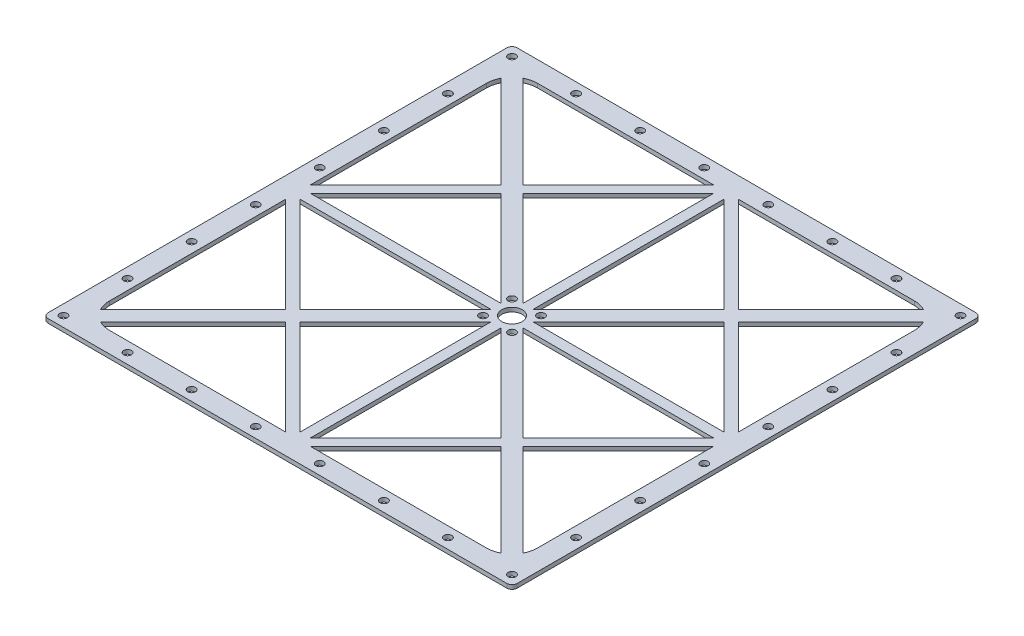
from build123d import *

# Parameters (mm, degrees)
SKETCH1_W           = 183
SKETCH1_H           = 183
SKETCH1_R           = 1.5
BOSS_EXTRUDE1_DEPTH = 1.6
CUT_EXTRUDE1_DEPTH  = 2
FILLET1_R           = 2
SKETCH3_R           = 1.5
CUT_EXTRUDE2_DEPTH  = 259.806027751
BOSS_EXTRUDE2_DEPTH = 1.6
SKETCH8_R           = 4
CUT_EXTRUDE4_DEPTH  = 259.806027751
BOSS_EXTRUDE4_DEPTH = 1.6
SKETCH7_R           = 1.5
CUT_EXTRUDE3_DEPTH  = 1.6


with BuildPart() as part:
    # Sketch1 → Boss-Extrude1 (new body)
    with BuildSketch(Plane(origin=(0, 0, 0), x_dir=(1, 0, 0), z_dir=(0, 1, 0))):
        with Locations((91.5, 91.5)):
            Rectangle(SKETCH1_W, SKETCH1_H)
        with Locations(Location((85.843145751, 97.156854249, 0), (0, 0, 270))):
            Circle(SKETCH1_R, mode=Mode.SUBTRACT)
        with Locations(Location((97.156854249, 97.156854249, 0), (0, 0, 270))):
            Circle(SKETCH1_R, mode=Mode.SUBTRACT)
        with Locations(Location((97.156854249, 85.843145751, 0), (0, 0, 270))):
            Circle(SKETCH1_R, mode=Mode.SUBTRACT)
        with Locations(Location((85.843145751, 85.843145751, 0), (0, 0, 270))):
            Circle(SKETCH1_R, mode=Mode.SUBTRACT)
    extrude(amount=BOSS_EXTRUDE1_DEPTH)

    # Sketch2 → Cut-Extrude1 (cut)
    with BuildSketch(Plane(origin=(0, 1.6, 0), x_dir=(1, 0, 0), z_dir=(0, 1, 0))):
        with BuildLine():
            ThreePointArc((18, 175), (15.619547443, 174.712540637), (13.375951562, 173.866689125))
            Line((13.375951562, 173.866689125), (91.5, 95.742640687))
            Line((91.5, 95.742640687), (169.624048438, 173.866689125))
            ThreePointArc((169.624048438, 173.866689125), (167.380452557, 174.712540637), (165, 175))
            Line((165, 175), (18, 175))
        make_face()
        with BuildLine():
            Line((87.257359313, 91.5), (9.133310875, 169.624048438))
            ThreePointArc((9.133310875, 169.624048438), (8.287459244, 167.38045207), (8, 164.999998998))
            Line((8, 164.999998998), (8, 18))
            ThreePointArc((8, 18), (8.287459363, 15.619547443), (9.133310875, 13.375951562))
            Line((9.133310875, 13.375951562), (87.257359313, 91.5))
        make_face()
        with BuildLine():
            Line((169.624048438, 9.133310875), (91.5, 87.257359313))
            Line((91.5, 87.257359313), (13.375951562, 9.133310875))
            ThreePointArc((13.375951562, 9.133310875), (15.619547443, 8.287459363), (18, 8))
            Line((18, 8), (165, 8))
            ThreePointArc((165, 8), (167.380452557, 8.287459363), (169.624048438, 9.133310875))
        make_face()
        with BuildLine():
            Line((173.866689125, 169.624048438), (95.742640687, 91.5))
            Line((95.742640687, 91.5), (173.866689125, 13.375951562))
            ThreePointArc((173.866689125, 13.375951562), (174.712540518, 15.619546957), (175, 17.999998998))
            Line((175, 17.999998998), (175, 165))
            ThreePointArc((175, 165), (174.712540637, 167.380452557), (173.866689125, 169.624048438))
        make_face()
    extrude(amount=-CUT_EXTRUDE1_DEPTH, mode=Mode.SUBTRACT)

    # Fillet1
    fillet1_edges = [part.edges().sort_by_distance(p)[0] for p in [
        (0, 0.8, -183),
        (183, 0.8, -183),
        (183, 0.8, 0),
        (0, 0.8, 0),
    ]]
    fillet(fillet1_edges, radius=FILLET1_R)

    # Sketch3 → Cut-Extrude2 (cut, through all)
    with BuildSketch(Plane(origin=(0, 1.6, 0), x_dir=(1, 0, 0), z_dir=(0, 1, 0))):
        with Locations(Location((4, 179, 0), (0, 0, 270))):
            Circle(SKETCH3_R)
        with Locations(Location((179, 179, 0), (0, 0, 270))):
            Circle(SKETCH3_R)
        with Locations(Location((179, 4, 0), (0, 0, 270))):
            Circle(SKETCH3_R)
        with Locations(Location((4, 4, 0), (0, 0, 270))):
            Circle(SKETCH3_R)
    extrude(amount=-CUT_EXTRUDE2_DEPTH, mode=Mode.SUBTRACT)


with BuildPart() as boss_extrude2_tool:
    # Sketch4 → Boss-Extrude2 (new body)
    with BuildSketch(Plane(origin=(0, 1.6, 0), x_dir=(1, 0, 0), z_dir=(0, 1, 0))):
        Polygon((93.5, 89.5), (175.000001002, 89.500020414), (175, 93.500020414), (93.5, 93.5), (93.5, 175), (89.5, 175), (89.5, 93.499998998), (8, 93.499978584), (8.000001002, 89.499978584), (89.5, 89.499998998), (89.5, 8), (93.5, 8), align=None)
    extrude(amount=-BOSS_EXTRUDE2_DEPTH)


with BuildPart() as part_1:
    add(part.part)


with BuildPart() as part_2:
    # Boss-Extrude2: joined with boss_extrude2_tool
    add(part_1.part.fuse(boss_extrude2_tool.part, tol=0.00001))

    # Sketch8 → Cut-Extrude4 (cut, through all)
    with BuildSketch(Plane(origin=(0, 1.6, 0), x_dir=(1, 0, 0), z_dir=(0, 1, 0))):
        with Locations(Location((91.5, 91.5, 0), (0, 0, 270))):
            Circle(SKETCH8_R)
    extrude(amount=-CUT_EXTRUDE4_DEPTH, mode=Mode.SUBTRACT)


with BuildPart() as boss_extrude4_tool:
    # Sketch6 → Boss-Extrude4 (new body)
    with BuildSketch(Plane(origin=(0, 1.6, 0), x_dir=(1, 0, 0), z_dir=(0, 1, 0))):
        Polygon((10.828426788, 89.499979292), (89.5, 10.828426753), (89.5, 8), (86.671572504, 8), (8, 86.671551831), (8, 89.499978584), align=None)
        Polygon((8, 93.500021416), (10.828426788, 93.500020708), (89.5, 172.171573247), (89.5, 175), (86.671572504, 175), (8, 96.328448169), align=None)
        Polygon((172.171573212, 93.500020708), (93.5, 172.171573247), (93.5, 175), (96.328427496, 175), (175, 96.328448169), (175, 93.500021416), align=None)
        Polygon((175, 89.499978584), (172.171573212, 89.499979292), (93.5, 10.828426753), (93.5, 8), (96.328427496, 8), (175, 86.671551831), align=None)
    extrude(amount=-BOSS_EXTRUDE4_DEPTH)


with BuildPart() as part_3:
    add(part_2.part)


with BuildPart() as part_4:
    # Boss-Extrude4: joined with boss_extrude4_tool
    add(part_3.part.fuse(boss_extrude4_tool.part, tol=0.00001))

    # Sketch7 → Cut-Extrude3 (cut)
    with BuildSketch(Plane(origin=(0, 1.6, 0), x_dir=(1, 0, 0), z_dir=(0, 1, 0))):
        with Locations(Location((29, 179, 0), (0, 0, 270))):
            Circle(SKETCH7_R)
        with Locations(Location((4, 29, 0), (0, 0, 270))):
            Circle(SKETCH7_R)
        with Locations(Location((4, 54, 0), (0, 0, 270))):
            Circle(SKETCH7_R)
        with Locations(Location((4, 79, 0), (0, 0, 270))):
            Circle(SKETCH7_R)
        with Locations(Location((4, 104, 0), (0, 0, 270))):
            Circle(SKETCH7_R)
        with Locations(Location((4, 129, 0), (0, 0, 270))):
            Circle(SKETCH7_R)
        with Locations(Location((4, 154, 0), (0, 0, 270))):
            Circle(SKETCH7_R)
        with Locations(Location((54, 179, 0), (0, 0, 270))):
            Circle(SKETCH7_R)
        with Locations(Location((79, 179, 0), (0, 0, 270))):
            Circle(SKETCH7_R)
        with Locations(Location((104, 179, 0), (0, 0, 270))):
            Circle(SKETCH7_R)
        with Locations(Location((129, 179, 0), (0, 0, 270))):
            Circle(SKETCH7_R)
        with Locations(Location((154, 179, 0), (0, 0, 270))):
            Circle(SKETCH7_R)
        with Locations(Location((179, 154, 0), (0, 0, 270))):
            Circle(SKETCH7_R)
        with Locations(Location((179, 129, 0), (0, 0, 270))):
            Circle(SKETCH7_R)
        with Locations(Location((179, 104, 0), (0, 0, 270))):
            Circle(SKETCH7_R)
        with Locations(Location((179, 79, 0), (0, 0, 270))):
            Circle(SKETCH7_R)
        with Locations(Location((179, 54, 0), (0, 0, 270))):
            Circle(SKETCH7_R)
        with Locations(Location((179, 29, 0), (0, 0, 270))):
            Circle(SKETCH7_R)
        with Locations(Location((154, 4, 0), (0, 0, 270))):
            Circle(SKETCH7_R)
        with Locations(Location((129, 4, 0), (0, 0, 270))):
            Circle(SKETCH7_R)
        with Locations(Location((104, 4, 0), (0, 0, 270))):
            Circle(SKETCH7_R)
        with Locations(Location((79, 4, 0), (0, 0, 270))):
            Circle(SKETCH7_R)
        with Locations(Location((54, 4, 0), (0, 0, 270))):
            Circle(SKETCH7_R)
        with Locations(Location((29, 4, 0), (0, 0, 270))):
            Circle(SKETCH7_R)
    extrude(amount=-CUT_EXTRUDE3_DEPTH, mode=Mode.SUBTRACT)


solid = part_4.part
